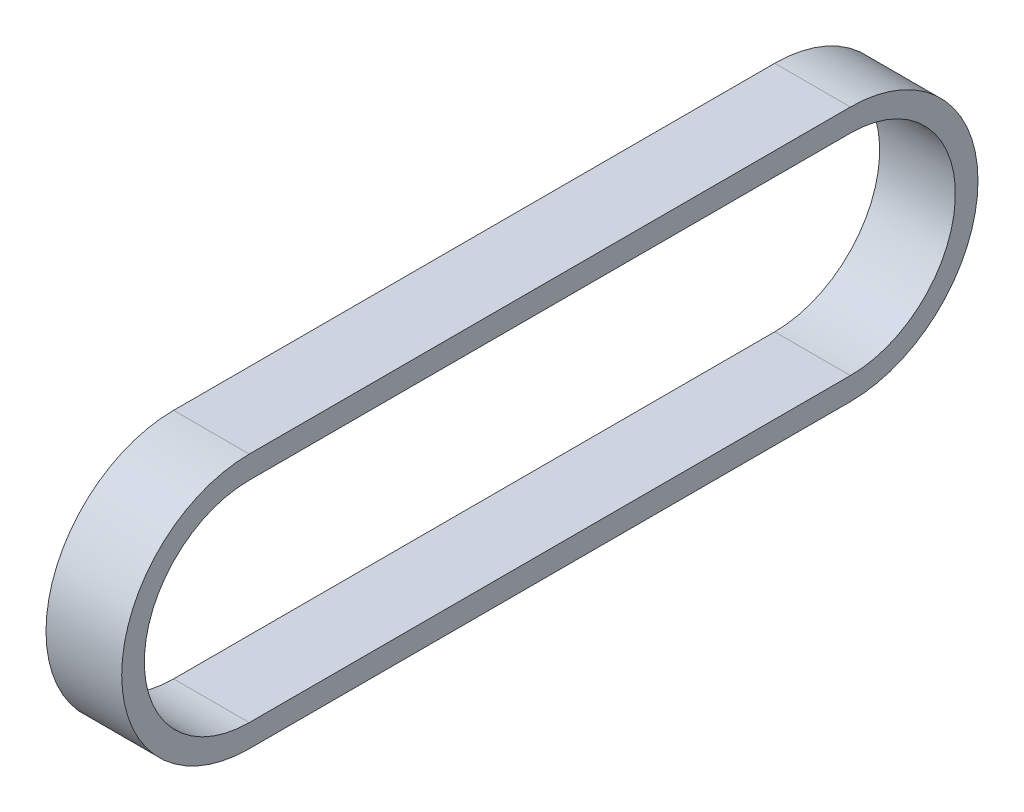
from build123d import *

# Parameters (mm, degrees)
EXTRUDE_THIN1_DEPTH = 8.5


with BuildPart() as part:
    # Sketch1 → Extrude-Thin1 (new body)
    with BuildSketch(Plane(origin=(0, 0, 0), x_dir=(0, 0, -1), z_dir=(1, 0, 0))):
        with BuildLine():
            Line((33.7439, -14.3256), (-33.7439, -14.3256))
            ThreePointArc((-33.7439, -14.3256), (-48.0695, 0), (-33.7439, 14.3256))
            Line((-33.7439, 14.3256), (33.7439, 14.3256))
            ThreePointArc((33.7439, 14.3256), (48.0695, 0), (33.7439, -14.3256))
        make_face()
        with BuildLine():
            Line((33.7439, -11.7856), (-33.7439, -11.7856))
            ThreePointArc((-33.7439, -11.7856), (-45.5295, 0), (-33.7439, 11.7856))
            Line((-33.7439, 11.7856), (33.7439, 11.7856))
            ThreePointArc((33.7439, 11.7856), (45.5295, 0), (33.7439, -11.7856))
        make_face(mode=Mode.SUBTRACT)
    extrude(amount=EXTRUDE_THIN1_DEPTH)


solid = part.part
